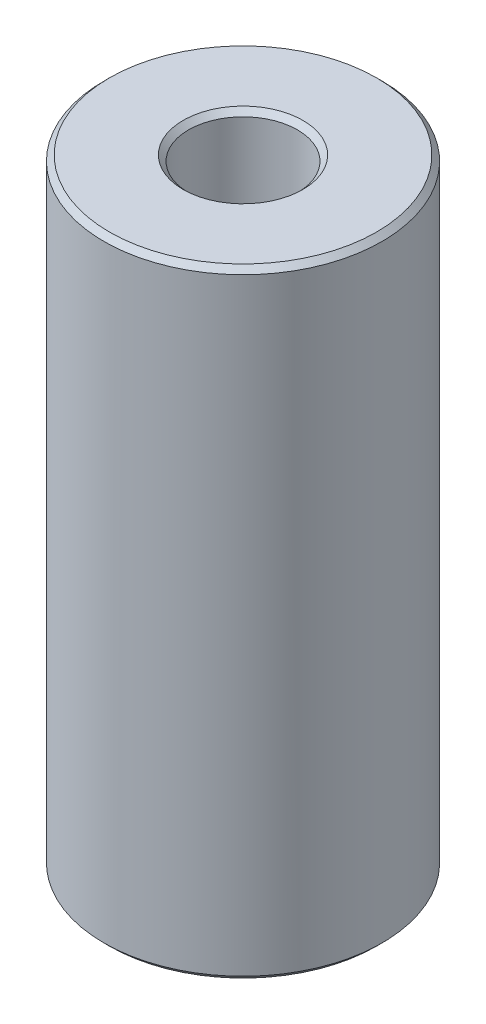
from build123d import *

# Parameters (mm, degrees)
SKETCH1_R           = 12.5
BOSS_EXTRUDE1_DEPTH = 55.606936458
SKETCH2_R           = 4.894603973
CUT_EXTRUDE1_DEPTH  = 59.349219209
CHAMFER1_SIZE       = 0.490488283


with BuildPart() as part:
    # Sketch1 → Boss-Extrude1 (new body)
    with BuildSketch(Plane(origin=(0, 0, 0), x_dir=(1, 0, 0), z_dir=(0, 1, 0))):
        Circle(SKETCH1_R)
    extrude(amount=BOSS_EXTRUDE1_DEPTH)

    # Sketch2 → Cut-Extrude1 (cut, through all)
    with BuildSketch(Plane(origin=(0, 0, 0), x_dir=(1, 0, 0), z_dir=(0, 1, 0))):
        Circle(SKETCH2_R)
    extrude(amount=CUT_EXTRUDE1_DEPTH, mode=Mode.SUBTRACT)

    # Chamfer1
    chamfer1_edges = [part.edges().sort_by_distance(p)[0] for p in [
        (-4.894603973, 55.606936458, 0),
        (-4.894603973, 0, 0),
        (-12.5, 0, 0),
        (-12.5, 55.606936458, 0),
    ]]
    chamfer(chamfer1_edges, length=CHAMFER1_SIZE)


solid = part.part
